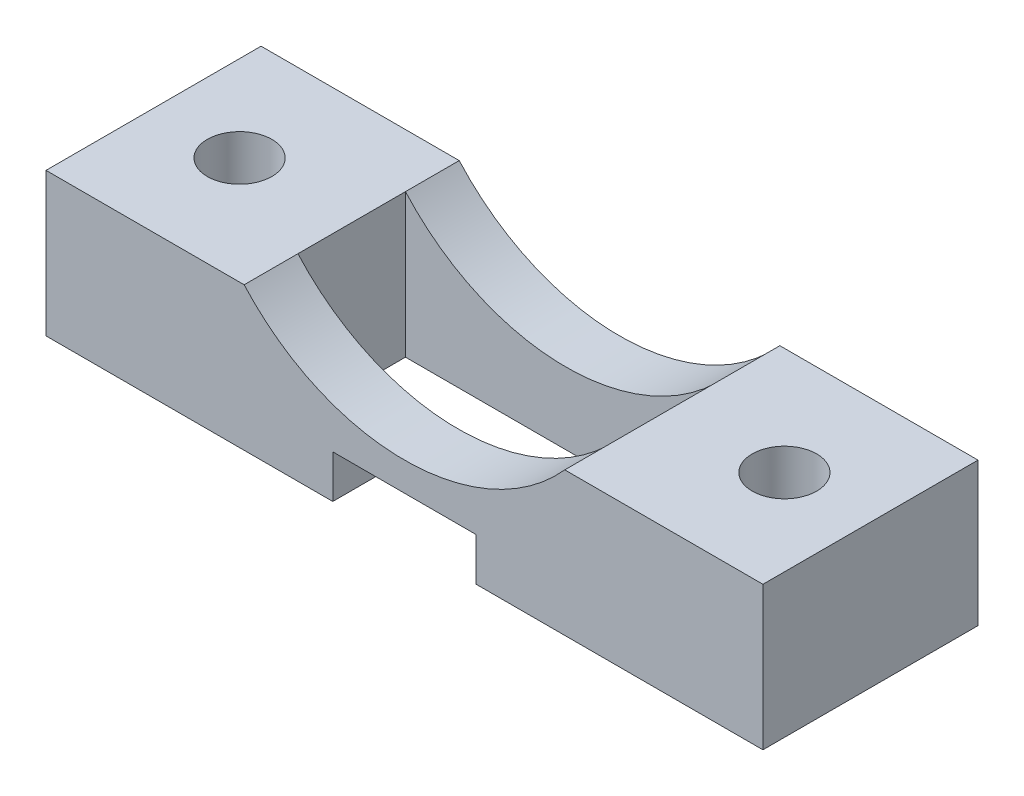
from build123d import *

# Parameters (mm, degrees)
BOSS_EXTRUDE1_DEPTH = 15
CUT_EXTRUDE1_REACH  = 32.822
SKETCH3_W           = 22.360679774
SKETCH3_H           = 7.5
CUT_EXTRUDE2_REACH  = 31.58
SKETCH2_W           = 10
SKETCH2_H           = 3
CUT_EXTRUDE3_REACH  = 32.822
SKETCH4_R           = 2.25
SHELL2_START        = 1
SHELL2_OUTLINE_W    = 11.819660113
SHELL2_OUTLINE_H    = 8
SHELL2_DEPTH        = 3.2499999
SHELL2_START_2      = 10.7500001
SHELL2_2_OUTLINE_W  = 11.819660113
SHELL2_2_OUTLINE_H  = 8
SHELL2_2_DEPTH      = 3.2499999
SHELL2_3_DEPTH      = 1.75
SHELL2_START_3      = 12.25
SHELL2_4_DEPTH      = 1.75
SHELL2_START_4      = -4
SHELL2_5_DEPTH      = 8


with BuildPart() as part:
    # Sketch1 → Boss-Extrude1 (new body)
    with BuildSketch(Plane.XY):
        with BuildLine():
            Line((-25, 5), (-11.180339887, 5))
            ThreePointArc((-11.180339887, 5), (0, 0), (11.180339887, 5))
            Line((11.180339887, 5), (25, 5))
            Line((25, 5), (25, -5))
            Line((25, -5), (-25, -5))
            Line((-25, -5), (-25, 5))
        make_face()
    extrude(amount=BOSS_EXTRUDE1_DEPTH)

    # Sketch3 → Cut-Extrude1 (cut, up to next)
    with BuildSketch(Plane(origin=(0, 5, 0), x_dir=(1, 0, 0), z_dir=(0, 1, 0)), mode=Mode.PRIVATE) as cut_extrude1_sk1:
        with Locations((0, -7.5)):
            Rectangle(SKETCH3_W, SKETCH3_H)
    cut_extrude1_tool1 = extrude(cut_extrude1_sk1.sketch, amount=-CUT_EXTRUDE1_REACH, mode=Mode.PRIVATE) & part.part
    add(cut_extrude1_tool1.solids().sort_by_distance((0, 5, 7.5))[0], mode=Mode.SUBTRACT)

    # Sketch2 → Cut-Extrude2 (cut, up to next)
    with BuildSketch(Plane.XY.offset(15), mode=Mode.PRIVATE) as cut_extrude2_sk1:
        with Locations((0, -3.5)):
            Rectangle(SKETCH2_W, SKETCH2_H)
    cut_extrude2_tool1 = extrude(cut_extrude2_sk1.sketch, amount=-CUT_EXTRUDE2_REACH, mode=Mode.PRIVATE) & part.part
    add(cut_extrude2_tool1.solids().sort_by_distance((0, -3.5, 15))[0], mode=Mode.SUBTRACT)

    # Sketch4 → Cut-Extrude3 (cut, up to next)
    with BuildSketch(Plane(origin=(0, 5, 0), x_dir=(1, 0, 0), z_dir=(0, 1, 0)), mode=Mode.PRIVATE) as cut_extrude3_sk1:
        with Locations(Location((-19, -7.5, 0), (0, 0, 270))):
            Circle(SKETCH4_R)
    cut_extrude3_tool1 = extrude(cut_extrude3_sk1.sketch, amount=-CUT_EXTRUDE3_REACH, mode=Mode.PRIVATE) & part.part
    # Sketch4 → Cut-Extrude3 (cut, up to next)
    with BuildSketch(Plane(origin=(0, 5, 0), x_dir=(1, 0, 0), z_dir=(0, 1, 0)), mode=Mode.PRIVATE) as cut_extrude3_sk2:
        with Locations(Location((19, -7.5, 0), (0, 0, 270))):
            Circle(SKETCH4_R)
    cut_extrude3_tool2 = extrude(cut_extrude3_sk2.sketch, amount=-CUT_EXTRUDE3_REACH, mode=Mode.PRIVATE) & part.part
    add(cut_extrude3_tool1.solids().sort_by_distance((-19, 5, 7.5))[0], mode=Mode.SUBTRACT)
    add(cut_extrude3_tool2.solids().sort_by_distance((19, 5, 7.5))[0], mode=Mode.SUBTRACT)

    # Shell2: read off the stored shape, not the designer's step
    # Shell2 outline → Shell2 (cut)
    with BuildSketch(Plane.XY.offset(SHELL2_START)):
        with Locations((18.090169944, 0)):
            Rectangle(SHELL2_OUTLINE_W, SHELL2_OUTLINE_H)
        with Locations((-18.090169944, 0)):
            Rectangle(SHELL2_OUTLINE_W, SHELL2_OUTLINE_H)
    extrude(amount=SHELL2_DEPTH, mode=Mode.SUBTRACT)

    # Shell2 2 outline → Shell2 2 (cut)
    with BuildSketch(Plane.XY.offset(SHELL2_START_2)):
        with Locations((18.090169944, 0)):
            Rectangle(SHELL2_2_OUTLINE_W, SHELL2_2_OUTLINE_H)
        with Locations((-18.090169944, 0)):
            Rectangle(SHELL2_2_OUTLINE_W, SHELL2_2_OUTLINE_H)
    extrude(amount=SHELL2_2_DEPTH, mode=Mode.SUBTRACT)

    # Shell2 3 outline → Shell2 3 (cut)
    with BuildSketch(Plane.XY.offset(SHELL2_START)):
        with BuildLine():
            Line((12.180339887, 4), (11.618950039, 4))
            ThreePointArc((11.618950039, 4), (0, -1), (-11.618950039, 4))
            Line((-11.618950039, 4), (-12.180339887, 4))
            Line((-12.180339887, 4), (-12.180339887, -4))
            Line((-12.180339887, -4), (12.180339887, -4))
            Line((12.180339887, -4), (12.180339887, 4))
        make_face()
    extrude(amount=SHELL2_3_DEPTH, mode=Mode.SUBTRACT)

    # Shell2 4 outline → Shell2 4 (cut)
    with BuildSketch(Plane.XY.offset(SHELL2_START_3)):
        with BuildLine():
            Line((12.180339887, 4), (11.618950039, 4))
            ThreePointArc((11.618950039, 4), (6.324555321, 0.303061543), (0, -1))
            Line((0, -1), (6, -1))
            Line((6, -1), (6, -4))
            Line((6, -4), (12.180339887, -4))
            Line((12.180339887, -4), (12.180339887, 4))
        make_face()
        with BuildLine():
            Line((-6, -1), (0, -1))
            ThreePointArc((0, -1), (-6.324555321, 0.303061543), (-11.618950039, 4))
            Line((-11.618950039, 4), (-12.180339887, 4))
            Line((-12.180339887, 4), (-12.180339887, -4))
            Line((-12.180339887, -4), (-6, -4))
            Line((-6, -4), (-6, -1))
        make_face()
    extrude(amount=SHELL2_4_DEPTH, mode=Mode.SUBTRACT)

    # Shell2 5 outline → Shell2 5 (cut)
    with BuildSketch(Plane(origin=(0, 0, 0), x_dir=(1, 0, 0), z_dir=(0, 1, 0)).offset(SHELL2_START_4)):
        with BuildLine():
            Line((24, -10.7500001), (24, -4.2499999))
            Line((24, -4.2499999), (19, -4.25))
            ThreePointArc((19, -4.25), (22.25, -7.5), (19, -10.75))
            Line((19, -10.75), (24, -10.7500001))
        make_face()
        with BuildLine():
            ThreePointArc((19, -10.75), (15.75, -7.5), (19, -4.25))
            Line((19, -4.25), (12.180339887, -4.2499999))
            Line((12.180339887, -4.2499999), (12.180339887, -10.7500001))
            Line((12.180339887, -10.7500001), (19, -10.75))
        make_face()
        with BuildLine():
            Line((-24, -4.2499999), (-24, -10.7500001))
            Line((-24, -10.7500001), (-19, -10.75))
            ThreePointArc((-19, -10.75), (-22.25, -7.5), (-19, -4.25))
            Line((-19, -4.25), (-24, -4.2499999))
        make_face()
        with BuildLine():
            ThreePointArc((-19, -4.25), (-15.75, -7.5), (-19, -10.75))
            Line((-19, -10.75), (-12.180339887, -10.7500001))
            Line((-12.180339887, -10.7500001), (-12.180339887, -4.2499999))
            Line((-12.180339887, -4.2499999), (-19, -4.25))
        make_face()
    extrude(amount=SHELL2_5_DEPTH, mode=Mode.SUBTRACT)


solid = part.part
